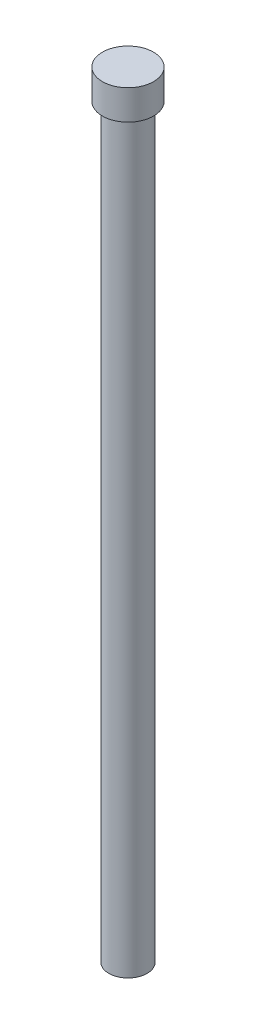
from build123d import *

# Parameters (mm, degrees)
SKETCH1_R           = 0.9
BOSS_EXTRUDE1_DEPTH = 35
SKETCH2_R           = 1.2
BOSS_EXTRUDE2_DEPTH = 1.4


with BuildPart() as part:
    # Sketch1 → Boss-Extrude1 (new body)
    with BuildSketch(Plane(origin=(0, 0, 0), x_dir=(1, 0, 0), z_dir=(0, 1, 0))):
        Circle(SKETCH1_R)
    extrude(amount=BOSS_EXTRUDE1_DEPTH)

    # Sketch2 → Boss-Extrude2 (add)
    with BuildSketch(Plane(origin=(0, 35, 0), x_dir=(1, 0, 0), z_dir=(0, 1, 0))):
        Circle(SKETCH2_R)
    extrude(amount=BOSS_EXTRUDE2_DEPTH)


solid = part.part
